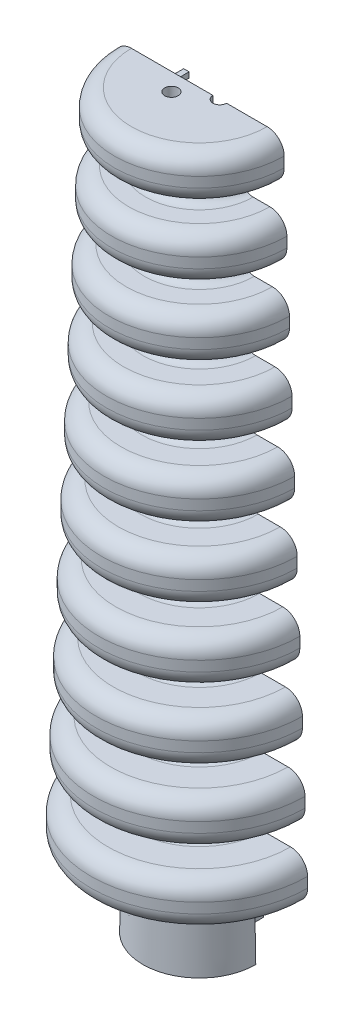
from build123d import *

# Parameters (mm, degrees)
OTHER_START              = 11.041
OTHER_1_OUTLINE_R        = 15.924075195
OTHER_1_DEPTH            = 6.5
OTHER_START_2            = 21.041
OTHER_1_2_OUTLINE_R      = 15.54256684
OTHER_1_2_DEPTH          = 6.5
OTHER_START_3            = 31.041
OTHER_1_3_OUTLINE_R      = 15.161058485
OTHER_1_3_DEPTH          = 6.5
OTHER_START_4            = 41.041
OTHER_1_4_OUTLINE_R      = 14.77955013
OTHER_1_4_DEPTH          = 6.5
OTHER_START_5            = 51.041
OTHER_1_5_OUTLINE_R      = 14.398041775
OTHER_1_5_DEPTH          = 6.5
OTHER_START_6            = 61.041
OTHER_1_6_OUTLINE_R      = 14.01653342
OTHER_1_6_DEPTH          = 6.5
OTHER_START_7            = 71.041
OTHER_1_7_OUTLINE_R      = 13.635025065
OTHER_1_7_DEPTH          = 6.5
OTHER_START_8            = 81.041
OTHER_1_8_OUTLINE_R      = 13.25451671
OTHER_1_8_DEPTH          = 6.5
OTHER_START_9            = 91.041
OTHER_1_9_OUTLINE_R      = 12.873008355
OTHER_1_9_DEPTH          = 6.5
FILLET_4_R               = 2.5
FILLET_5_R               = 1.5
SHELL_2_T                = -1.5
SKETCH_11_R              = 1
CUT_EXTRUDE_5_DEPTH      = 5
PATTERN_CIRCULAR_2_COUNT = 3
SKETCH_8_R               = 79.05648806
CUT_EXTRUDE_8_DEPTH      = 31
SKETCH_13_W              = 0.8
SKETCH_13_H              = 0.8
EXTRUDE_2_DEPTH          = 1.6


# Read off the part's stored shape, not the designer's step: 变量阵列1
with BuildPart() as part:
    # 草图3 → 旋转4 (revolve)
    with BuildSketch(Plane.XY, mode=Mode.PRIVATE) as revolve_4_sk:
        Polygon((0, 0), (-8.3, 0), (-6.2405, 107.541), (0, 107.541), align=None)
    revolve(revolve_4_sk.sketch.rotate(Axis((0, 0, 0), (0, 1, 0)), 270), axis=Axis((0, 0, 0), (0, 1, 0)))

    # 草图4 → 旋转5 (revolve)
    with BuildSketch(Plane(origin=(0, 0, 0), x_dir=(0, 0, -1), z_dir=(1, 0, 0))):
        Polygon((6.364980431, 101.041), (6.2405, 107.541), (12.4815, 107.541), (12.4815, 101.041), align=None)
    revolve(axis=Axis((0, 0, 0), (0, 1, 0)))

    # Other 1 outline → Other 1 (add)
    with BuildSketch(Plane(origin=(0, 0, 0), x_dir=(1, 0, 0), z_dir=(0, 1, 0)).offset(OTHER_START)):
        Circle(OTHER_1_OUTLINE_R)
    extrude(amount=OTHER_1_DEPTH)

    # Other 1 2 outline → Other 1 2 (add)
    with BuildSketch(Plane(origin=(0, 0, 0), x_dir=(1, 0, 0), z_dir=(0, 1, 0)).offset(OTHER_START_2)):
        Circle(OTHER_1_2_OUTLINE_R)
    extrude(amount=OTHER_1_2_DEPTH)

    # Other 1 3 outline → Other 1 3 (add)
    with BuildSketch(Plane(origin=(0, 0, 0), x_dir=(1, 0, 0), z_dir=(0, 1, 0)).offset(OTHER_START_3)):
        Circle(OTHER_1_3_OUTLINE_R)
    extrude(amount=OTHER_1_3_DEPTH)

    # Other 1 4 outline → Other 1 4 (add)
    with BuildSketch(Plane(origin=(0, 0, 0), x_dir=(1, 0, 0), z_dir=(0, 1, 0)).offset(OTHER_START_4)):
        Circle(OTHER_1_4_OUTLINE_R)
    extrude(amount=OTHER_1_4_DEPTH)

    # Other 1 5 outline → Other 1 5 (add)
    with BuildSketch(Plane(origin=(0, 0, 0), x_dir=(1, 0, 0), z_dir=(0, 1, 0)).offset(OTHER_START_5)):
        Circle(OTHER_1_5_OUTLINE_R)
    extrude(amount=OTHER_1_5_DEPTH)

    # Other 1 6 outline → Other 1 6 (add)
    with BuildSketch(Plane(origin=(0, 0, 0), x_dir=(1, 0, 0), z_dir=(0, 1, 0)).offset(OTHER_START_6)):
        Circle(OTHER_1_6_OUTLINE_R)
    extrude(amount=OTHER_1_6_DEPTH)

    # Other 1 7 outline → Other 1 7 (add)
    with BuildSketch(Plane(origin=(0, 0, 0), x_dir=(1, 0, 0), z_dir=(0, 1, 0)).offset(OTHER_START_7)):
        Circle(OTHER_1_7_OUTLINE_R)
    extrude(amount=OTHER_1_7_DEPTH)

    # Other 1 8 outline → Other 1 8 (add)
    with BuildSketch(Plane(origin=(0, 0, 0), x_dir=(1, 0, 0), z_dir=(0, 1, 0)).offset(OTHER_START_8)):
        Circle(OTHER_1_8_OUTLINE_R)
    extrude(amount=OTHER_1_8_DEPTH)

    # Other 1 9 outline → Other 1 9 (add)
    with BuildSketch(Plane(origin=(0, 0, 0), x_dir=(1, 0, 0), z_dir=(0, 1, 0)).offset(OTHER_START_9)):
        Circle(OTHER_1_9_OUTLINE_R)
    extrude(amount=OTHER_1_9_DEPTH)

    # 圆角4
    fillet_4_edges = [part.edges().sort_by_distance(p)[0] for p in [
        (0, 101.041, 12.4815),
        (0, 107.541, 12.4815),
        (-12.873008355, 91.041, 0),
        (-12.873008355, 97.541, 0),
        (-13.25451671, 81.041, 0),
        (-13.25451671, 87.541, 0),
        (-13.635025065, 71.041, 0),
        (-13.635025065, 77.541, 0),
        (-14.01653342, 61.041, 0),
        (-14.01653342, 67.541, 0),
        (-14.398041775, 51.041, 0),
        (-14.398041775, 57.541, 0),
        (-14.77955013, 41.041, 0),
        (-14.77955013, 47.541, 0),
        (-15.161058485, 31.041, 0),
        (-15.161058485, 37.541, 0),
        (-15.54256684, 21.041, 0),
        (-15.54256684, 27.541, 0),
        (-15.924075195, 11.041, 0),
        (-15.924075195, 17.541, 0),
    ]]
    fillet(fillet_4_edges, radius=FILLET_4_R)

    # 圆角5
    fillet_5_edges = [part.edges().sort_by_distance(p)[0] for p in [
        (0, 101.041, 6.364980431),
        (0, 97.541, 6.432008355),
        (0, 91.041, 6.556488786),
        (0, 87.541, 6.62351671),
        (0, 81.041, 6.747997141),
        (0, 77.541, 6.815025065),
        (0, 71.041, 6.939505496),
        (0, 67.541, 7.00653342),
        (0, 61.041, 7.131013851),
        (0, 57.541, 7.198041775),
        (0, 51.041, 7.322522205),
        (0, 47.541, 7.38955013),
        (0, 41.041, 7.51403056),
        (0, 37.541, 7.581058485),
        (0, 31.041, 7.705538915),
        (0, 27.541, 7.77256684),
        (0, 21.041, 7.89704727),
        (0, 17.541, 7.964075195),
        (0, 11.041, 8.088555625),
    ]]
    fillet(fillet_5_edges, radius=FILLET_5_R)

    # 抽壳2
    shell_2_openings = [part.faces().sort_by_distance(p)[0] for p in [
        (0, 0, 0),
    ]]
    offset(amount=SHELL_2_T, openings=shell_2_openings, kind=Kind.INTERSECTION)

    # 草图11 → 切除-拉伸5 (cut)
    with BuildSketch(Plane(origin=(0, 107.541, 0), x_dir=(1, 0, 0), z_dir=(0, 1, 0))):
        with Locations(Location((3, 0, 0), (0, 0, 270))):
            Circle(SKETCH_11_R)
    cut_extrude_5 = extrude(amount=-CUT_EXTRUDE_5_DEPTH, mode=Mode.SUBTRACT)

    # 阵列(圆周)2: 切除-拉伸5 ×3 about axis
    pattern_circular_2_axis = Axis((0, 0, 0), (0, 1, 0))
    for i in range(1, PATTERN_CIRCULAR_2_COUNT):
        add(cut_extrude_5.rotate(pattern_circular_2_axis, i * 360 / PATTERN_CIRCULAR_2_COUNT), mode=Mode.SUBTRACT)

    # 草图8 → 切除-拉伸8 (cut)
    with BuildSketch(Plane.XY):
        with Locations((0, 57.213723454)):
            Circle(SKETCH_8_R)
    extrude(amount=-CUT_EXTRUDE_8_DEPTH, mode=Mode.SUBTRACT)

    # 草图13 → 凸台-拉伸2 (add)
    with BuildSketch(Plane(origin=(0, 0, 0), x_dir=(-1, 0, 0), z_dir=(0, 0, -1))):
        with Locations((3.5, 106.791)):
            Rectangle(SKETCH_13_W, SKETCH_13_H)
        with Locations((7.446447968, 5.4)):
            Rectangle(SKETCH_13_W, SKETCH_13_H)
        with Locations((-7.446447968, 5.4)):
            Rectangle(SKETCH_13_W, SKETCH_13_H)
    extrude(amount=EXTRUDE_2_DEPTH)


solid = part.part
